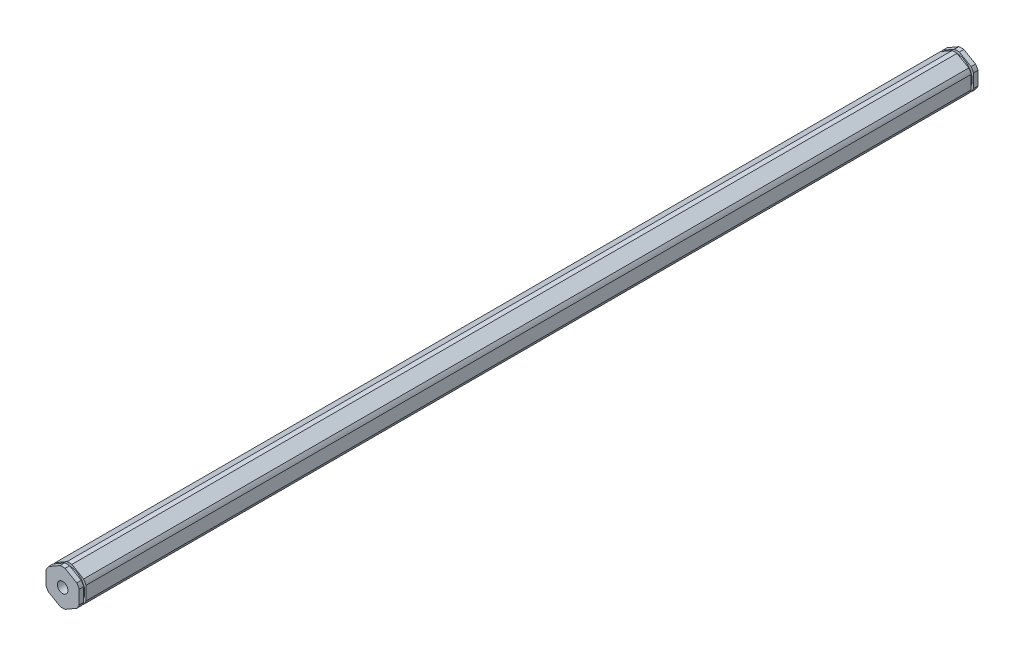
from build123d import *

# Parameters (mm, degrees)
BOSS_EXTRUDE1_DEPTH                  = 171.73575
F_10_32_TAPPED_HOLE1_D               = 4.0386
F_10_32_TAPPED_HOLE1_DEPTH           = 16.34744
F_10_32_TAPPED_HOLE1_TIP             = 1.213317848
F_10_32_TAPPED_HOLE1_ON_FACE_2_D     = 4.0386
F_10_32_TAPPED_HOLE1_ON_FACE_2_DEPTH = 16.34744
F_10_32_TAPPED_HOLE1_ON_FACE_2_TIP   = 1.213317848
SKETCH5_W                            = 0.889
SKETCH5_H                            = 1.0033


with BuildPart() as part:
    # Sketch1 → Boss-Extrude1 (new, symmetric)
    with BuildSketch(Plane.XY):
        with BuildLine():
            ThreePointArc((0.93173274, 6.79441227), (0, 6.858), (-0.93173274, 6.79441227))
            Line((-0.93173274, 6.79441227), (-5.41826726, 4.204110358))
            ThreePointArc((-5.41826726, 4.204110358), (-5.939202219, 3.429), (-6.35, 2.590301913))
            Line((-6.35, 2.590301913), (-6.35, -2.590301913))
            ThreePointArc((-6.35, -2.590301913), (-5.939202219, -3.429), (-5.41826726, -4.204110358))
            Line((-5.41826726, -4.204110358), (-0.93173274, -6.79441227))
            ThreePointArc((-0.93173274, -6.79441227), (0, -6.858), (0.93173274, -6.79441227))
            Line((0.93173274, -6.79441227), (5.41826726, -4.204110358))
            ThreePointArc((5.41826726, -4.204110358), (5.939202219, -3.429), (6.35, -2.590301913))
            Line((6.35, -2.590301913), (6.35, 2.590301913))
            ThreePointArc((6.35, 2.590301913), (5.939202219, 3.429), (5.41826726, 4.204110358))
            Line((5.41826726, 4.204110358), (0.93173274, 6.79441227))
        make_face()
    extrude(amount=BOSS_EXTRUDE1_DEPTH, both=True)

    # #10-32 Tapped Hole1
    with Locations(Plane.XY.offset(171.73575)):
        with Locations((0, 0)):
            Hole(F_10_32_TAPPED_HOLE1_D / 2, depth=F_10_32_TAPPED_HOLE1_DEPTH)
            with Locations((0, 0, -(F_10_32_TAPPED_HOLE1_DEPTH + F_10_32_TAPPED_HOLE1_TIP / 2))):  # 118° drill point
                Cone(0, F_10_32_TAPPED_HOLE1_D / 2, F_10_32_TAPPED_HOLE1_TIP, mode=Mode.SUBTRACT)

    # #10-32 Tapped Hole1 on face 2
    with Locations(Plane(origin=(0, 0, -171.73575), x_dir=(-1, 0, 0), z_dir=(0, 0, -1))):
        with Locations((0, 0)):
            Hole(F_10_32_TAPPED_HOLE1_ON_FACE_2_D / 2, depth=F_10_32_TAPPED_HOLE1_ON_FACE_2_DEPTH)
            with Locations((0, 0, -(F_10_32_TAPPED_HOLE1_ON_FACE_2_DEPTH + F_10_32_TAPPED_HOLE1_ON_FACE_2_TIP / 2))):  # 118° drill point
                Cone(0, F_10_32_TAPPED_HOLE1_ON_FACE_2_D / 2, F_10_32_TAPPED_HOLE1_ON_FACE_2_TIP, mode=Mode.SUBTRACT)

    # Sketch5 → Cut-Revolve1 (revolve, cut)
    with BuildSketch(Plane(origin=(0, 0, 0), x_dir=(0, 0, -1), z_dir=(1, 0, 0))):
        with Locations((-169.57675, 6.35635)):
            Rectangle(SKETCH5_W, SKETCH5_H)
    cut_revolve1 = revolve(axis=Axis((0, 0, 165.047176272), (0, 0, -1)), mode=Mode.SUBTRACT)

    # Mirror1: Cut-Revolve1 across plane
    add(cut_revolve1.mirror(Plane.XY), mode=Mode.SUBTRACT)


solid = part.part
